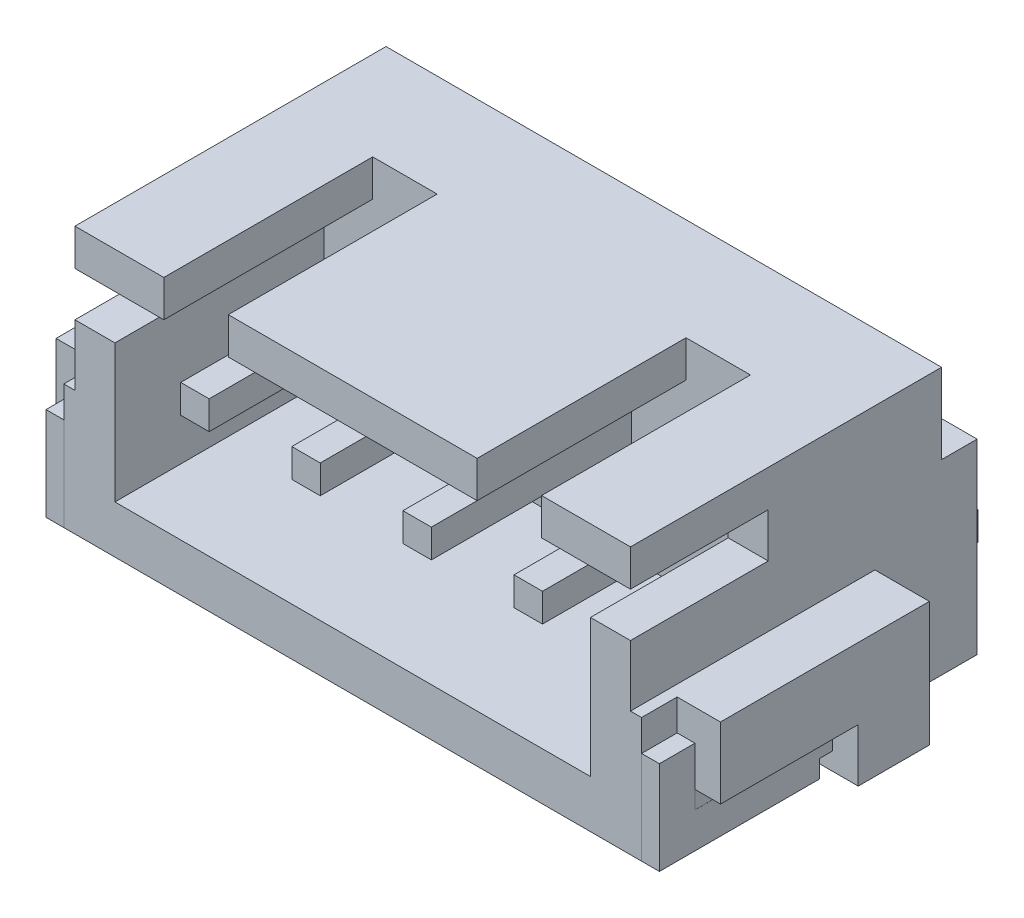
from build123d import *

# Parameters (mm, degrees)
BOSS_EXTRUDE1_START  = -5
BOSS_EXTRUDE1_DEPTH  = 6.86
BOSS_EXTRUDE2_START  = 0.64
BOSS_EXTRUDE2_DEPTH  = 0.64
BOSS_EXTRUDE3_DEPTH  = 0.64
CUT_EXTRUDE1_START   = -1.86
CUT_EXTRUDE1_DEPTH   = 1.86
CUT_EXTRUDE2_START   = -1.86
CUT_EXTRUDE2_DEPTH   = 1.86
CUT_EXTRUDE3_START   = -1.86
CUT_EXTRUDE3_DEPTH   = 1.86
SKETCH7_W            = 7
SKETCH7_H            = 6
BOSS_EXTRUDE4_DEPTH  = 2.18
SKETCH8_W            = 7
SKETCH8_H            = 6
BOSS_EXTRUDE5_DEPTH  = 2.18
SKETCH9_W            = 0.64
SKETCH9_H            = 0.64
BOSS_EXTRUDE6_DEPTH  = 2.2
SKETCH10_W           = 0.64
SKETCH10_H           = 0.64
BOSS_EXTRUDE7_DEPTH  = 2.2
SKETCH11_W           = 0.64
SKETCH11_H           = 0.64
BOSS_EXTRUDE8_DEPTH  = 2.2
SKETCH12_W           = 0.64
SKETCH12_H           = 0.64
BOSS_EXTRUDE9_DEPTH  = 2.2
BOSS_EXTRUDE10_DEPTH = 2.8
SKETCH14_W           = 0.574
SKETCH14_H           = 0.8
CUT_EXTRUDE4_DEPTH   = 3.1
SKETCH15_W           = 0.401
SKETCH15_H           = 3.1
CUT_EXTRUDE5_DEPTH   = 0.4
CUT_EXTRUDE6_REACH   = 17.295
SKETCH17_W           = 3.1
SKETCH17_H           = 0.4
SKETCH18_W           = 0.4
SKETCH18_H           = 2.8
BOSS_EXTRUDE11_DEPTH = 0.4
SKETCH19_W           = 0.4
SKETCH19_H           = 2.1
BOSS_EXTRUDE12_DEPTH = 0.8
BOSS_EXTRUDE13_DEPTH = 2.8
SKETCH21_W           = 0.574
SKETCH21_H           = 0.8
CUT_EXTRUDE7_DEPTH   = 3.1
SKETCH22_W           = 0.401
SKETCH22_H           = 3.1
CUT_EXTRUDE8_DEPTH   = 0.4
CUT_EXTRUDE9_REACH   = 18.36
SKETCH24_W           = 0.4
SKETCH24_H           = 3.1
SKETCH25_W           = 0.4
SKETCH25_H           = 2.8
BOSS_EXTRUDE14_DEPTH = 0.4
SKETCH26_W           = 0.4
SKETCH26_H           = 2.1
BOSS_EXTRUDE15_DEPTH = 0.8
SKETCH29_W           = 3.1
SKETCH29_H           = 1.825
CUT_EXTRUDE11_DEPTH  = 16.791631486
SKETCH30_W           = 2
SKETCH30_H           = 0.825
BOSS_EXTRUDE16_DEPTH = 3.1
SKETCH31_W           = 2
SKETCH31_H           = 0.825
BOSS_EXTRUDE17_DEPTH = 3.1
SKETCH32_W           = 8.5
SKETCH32_H           = 1.825
CUT_EXTRUDE12_DEPTH  = 1.6
CUT_EXTRUDE13_REACH  = 17.016
SKETCH33_W           = 1.6
SKETCH33_H           = 1
CUT_EXTRUDE14_REACH  = 17.016
SKETCH34_W           = 1
SKETCH34_H           = 1.6
SKETCH35_W           = 10.7
SKETCH35_H           = 4.7
CUT_EXTRUDE15_DEPTH  = 3.1
CUT_EXTRUDE16_REACH  = 12.388
SKETCH37_W           = 0.001
SKETCH37_H           = 3.1
SKETCH38_W           = 2.15
SKETCH38_H           = 4.2
BOSS_EXTRUDE18_DEPTH = 0.8
SKETCH39_W           = 1.3
SKETCH39_H           = 2.95
CUT_EXTRUDE17_DEPTH  = 0.8
SKETCH40_W           = 2.15
SKETCH40_H           = 4.2
BOSS_EXTRUDE19_DEPTH = 0.8
SKETCH41_W           = 1.3
SKETCH41_H           = 2.95
CUT_EXTRUDE18_DEPTH  = 0.8
SKETCH42_W           = 0.7
SKETCH42_H           = 0.3
CUT_EXTRUDE19_DEPTH  = 1.25
SKETCH43_W           = 1.8
SKETCH43_H           = 0.8
BOSS_EXTRUDE20_DEPTH = 1.25
SKETCH44_W           = 0.7
SKETCH44_H           = 0.3
CUT_EXTRUDE20_DEPTH  = 1.25
SKETCH45_W           = 1.8
SKETCH45_H           = 0.8
BOSS_EXTRUDE21_DEPTH = 1.25
SKETCH46_W           = 0.7
SKETCH46_H           = 0.3
CUT_EXTRUDE21_DEPTH  = 1.25
SKETCH47_W           = 1.8
SKETCH47_H           = 0.8
BOSS_EXTRUDE22_DEPTH = 1.25
CUT_EXTRUDE22_REACH  = 13.695
SKETCH48_W           = 0.7
SKETCH48_H           = 1.25
SKETCH49_W           = 0.64
SKETCH49_H           = 0.64
BOSS_EXTRUDE23_DEPTH = 4.5
SKETCH50_W           = 0.64
SKETCH50_H           = 0.64
BOSS_EXTRUDE24_DEPTH = 4.5
SKETCH51_W           = 0.64
SKETCH51_H           = 0.64
BOSS_EXTRUDE25_DEPTH = 4.5
SKETCH52_W           = 5.6
SKETCH52_H           = 0.825
BOSS_EXTRUDE26_DEPTH = 4.7
SKETCH53_W           = 0.64
SKETCH53_H           = 0.64
BOSS_EXTRUDE27_DEPTH = 4.5
FILLET1_R            = 0.64
FILLET2_R            = 1.28


with BuildPart() as part:
    # Boss-Extrude1: read off the stored shape, not the designer's step
    # Boss-Extrude1 outline → Boss-Extrude1 (new body)
    with BuildSketch(Plane.ZY.offset(1.57).offset(BOSS_EXTRUDE1_START)):
        with BuildLine():
            Line((-2, 3.08832021), (-2, 0))
            Line((-2, 0), (5, 0))
            Line((5, 0), (5, 6))
            Line((5, 6), (-2, 6))
            Line((-2, 6), (-2, 3.851591758))
            ThreePointArc((-2, 3.851591758), (-2.581319933, 3.380541753), (-2.8, 2.665))
            Line((-2.8, 2.665), (-2.8, 0))
            Line((-2.8, 0), (-2.16, 0))
            Line((-2.16, 0), (-2.16, 2.665))
            ThreePointArc((-2.16, 2.665), (-2.118665182, 2.89127417), (-2, 3.08832021))
        make_face()
    extrude(amount=BOSS_EXTRUDE1_DEPTH)

    # Sketch2 → Boss-Extrude2 (add)
    with BuildSketch(Plane(origin=(3.43, 0, 0), x_dir=(0, 0, -1), z_dir=(1, 0, 0)).offset(BOSS_EXTRUDE2_START)):
        with BuildLine():
            Line((2.8, 0), (2.16, 0))
            Line((2.16, 0), (2.16, 2.665))
            ThreePointArc((2.16, 2.665), (2.118665182, 2.89127417), (2, 3.08832021))
            Line((2, 3.08832021), (2, 0))
            Line((2, 0), (-5, 0))
            Line((-5, 0), (-5, 6))
            Line((-5, 6), (2, 6))
            Line((2, 6), (2, 3.851591758))
            ThreePointArc((2, 3.851591758), (2.581319933, 3.380541753), (2.8, 2.665))
            Line((2.8, 2.665), (2.8, 0))
        make_face()
    extrude(amount=-BOSS_EXTRUDE2_DEPTH)

    # Sketch3 → Boss-Extrude3 (add)
    with BuildSketch(Plane.ZY.offset(3.43)):
        with BuildLine():
            Line((-2.8, 0), (-2.8, 2.665))
            ThreePointArc((-2.8, 2.665), (-2.581319933, 3.380541753), (-2, 3.851591758))
            Line((-2, 3.851591758), (-2, 6))
            Line((-2, 6), (5, 6))
            Line((5, 6), (5, 0))
            Line((5, 0), (-2, 0))
            Line((-2, 0), (-2, 3.08832021))
            ThreePointArc((-2, 3.08832021), (-2.118665182, 2.89127417), (-2.16, 2.665))
            Line((-2.16, 2.665), (-2.16, 0))
            Line((-2.16, 0), (-2.8, 0))
        make_face()
    extrude(amount=BOSS_EXTRUDE3_DEPTH)

    # Sketch4 → Cut-Extrude1 (cut)
    with BuildSketch(Plane(origin=(-3.43, 0, 0), x_dir=(0, -1, 0), z_dir=(-1, 0, 0)).offset(CUT_EXTRUDE1_START)):
        with BuildLine():
            Line((-2.665, -2.8), (0, -2.8))
            Line((0, -2.8), (0, -2.16))
            Line((0, -2.16), (-2.665, -2.16))
            ThreePointArc((-2.665, -2.16), (-2.89127417, -2.118665182), (-3.08832021, -2))
            Line((-3.08832021, -2), (-3.851591758, -2))
            ThreePointArc((-3.851591758, -2), (-3.380541753, -2.581319933), (-2.665, -2.8))
        make_face()
    extrude(amount=CUT_EXTRUDE1_DEPTH, mode=Mode.SUBTRACT)

    # Sketch5 → Cut-Extrude2 (cut)
    with BuildSketch(Plane(origin=(-0.93, 0, 0), x_dir=(0, -1, 0), z_dir=(-1, 0, 0)).offset(CUT_EXTRUDE2_START)):
        with BuildLine():
            Line((-2.665, -2.8), (0, -2.8))
            Line((0, -2.8), (0, -2.16))
            Line((0, -2.16), (-2.665, -2.16))
            ThreePointArc((-2.665, -2.16), (-2.89127417, -2.118665182), (-3.08832021, -2))
            Line((-3.08832021, -2), (-3.851591758, -2))
            ThreePointArc((-3.851591758, -2), (-3.380541753, -2.581319933), (-2.665, -2.8))
        make_face()
    extrude(amount=CUT_EXTRUDE2_DEPTH, mode=Mode.SUBTRACT)

    # Sketch6 → Cut-Extrude3 (cut)
    with BuildSketch(Plane(origin=(1.57, 0, 0), x_dir=(0, -1, 0), z_dir=(-1, 0, 0)).offset(CUT_EXTRUDE3_START)):
        with BuildLine():
            Line((-2.665, -2.8), (0, -2.8))
            Line((0, -2.8), (0, -2.16))
            Line((0, -2.16), (-2.665, -2.16))
            ThreePointArc((-2.665, -2.16), (-2.89127417, -2.118665182), (-3.08832021, -2))
            Line((-3.08832021, -2), (-3.851591758, -2))
            ThreePointArc((-3.851591758, -2), (-3.380541753, -2.581319933), (-2.665, -2.8))
        make_face()
    extrude(amount=CUT_EXTRUDE3_DEPTH, mode=Mode.SUBTRACT)

    # Sketch7 → Boss-Extrude4 (add)
    with BuildSketch(Plane.ZY.offset(4.07)):
        with Locations((1.5, 3)):
            Rectangle(SKETCH7_W, SKETCH7_H)
    extrude(amount=BOSS_EXTRUDE4_DEPTH)

    # Sketch8 → Boss-Extrude5 (add)
    with BuildSketch(Plane(origin=(4.07, 0, 0), x_dir=(0, 0, -1), z_dir=(1, 0, 0))):
        with Locations((-1.5, 3)):
            Rectangle(SKETCH8_W, SKETCH8_H)
    extrude(amount=BOSS_EXTRUDE5_DEPTH)

    # Sketch9 → Boss-Extrude6 (add)
    with BuildSketch(Plane(origin=(0, 0, -2.8), x_dir=(-1, 0, 0), z_dir=(0, 0, -1))):
        with Locations((3.75, 0.32)):
            Rectangle(SKETCH9_W, SKETCH9_H)
    extrude(amount=BOSS_EXTRUDE6_DEPTH)

    # Sketch10 → Boss-Extrude7 (add)
    with BuildSketch(Plane(origin=(0, 0, -2.8), x_dir=(-1, 0, 0), z_dir=(0, 0, -1))):
        with Locations((1.25, 0.32)):
            Rectangle(SKETCH10_W, SKETCH10_H)
    extrude(amount=BOSS_EXTRUDE7_DEPTH)

    # Sketch11 → Boss-Extrude8 (add)
    with BuildSketch(Plane(origin=(0, 0, -2.8), x_dir=(-1, 0, 0), z_dir=(0, 0, -1))):
        with Locations((-1.25, 0.32)):
            Rectangle(SKETCH11_W, SKETCH11_H)
    extrude(amount=BOSS_EXTRUDE8_DEPTH)

    # Sketch12 → Boss-Extrude9 (add)
    with BuildSketch(Plane(origin=(0, 0, -2.8), x_dir=(-1, 0, 0), z_dir=(0, 0, -1))):
        with Locations((-3.75, 0.32)):
            Rectangle(SKETCH12_W, SKETCH12_H)
    extrude(amount=BOSS_EXTRUDE9_DEPTH)

    # Sketch13 → Boss-Extrude10 (add)
    with BuildSketch(Plane.XZ):
        Polygon((-7.475, -0.5), (-6.25, -0.5), (-6.25, 5), (-6.5, 5), (-6.5, 4.2), (-7.475, 4.2), align=None)
    extrude(amount=-BOSS_EXTRUDE10_DEPTH)

    # Sketch14 → Cut-Extrude4 (cut)
    with BuildSketch(Plane.XY.offset(4.2)):
        with Locations((-7.188, 0.4)):
            Rectangle(SKETCH14_W, SKETCH14_H)
    extrude(amount=-CUT_EXTRUDE4_DEPTH, mode=Mode.SUBTRACT)

    # Sketch15 → Cut-Extrude5 (cut)
    with BuildSketch(Plane.XZ):
        with Locations((-6.7005, 2.65)):
            Rectangle(SKETCH15_W, SKETCH15_H)
    extrude(amount=-CUT_EXTRUDE5_DEPTH, mode=Mode.SUBTRACT)

    # Sketch17 → Cut-Extrude6 (cut, up to next)
    with BuildSketch(Plane(origin=(-6.9, 0, 0), x_dir=(0, 0, -1), z_dir=(1, 0, 0)), mode=Mode.PRIVATE) as cut_extrude6_sk1:
        with Locations((-2.65, 1)):
            Rectangle(SKETCH17_W, SKETCH17_H)
    cut_extrude6_tool1 = extrude(cut_extrude6_sk1.sketch, amount=-CUT_EXTRUDE6_REACH, mode=Mode.PRIVATE) & part.part
    add(cut_extrude6_tool1.solids().sort_by_distance((-6.9, 1, 2.65))[0], mode=Mode.SUBTRACT)

    # Sketch18 → Boss-Extrude11 (add)
    with BuildSketch(Plane.XZ.offset(-0.4)):
        with Locations((-6.701, 2.8)):
            Rectangle(SKETCH18_W, SKETCH18_H)
    extrude(amount=BOSS_EXTRUDE11_DEPTH)

    # Sketch19 → Boss-Extrude12 (add)
    with BuildSketch(Plane.XY.offset(4.2)):
        with Locations((-6.701, 1.05)):
            Rectangle(SKETCH19_W, SKETCH19_H)
    extrude(amount=BOSS_EXTRUDE12_DEPTH)

    # Sketch20 → Boss-Extrude13 (add)
    with BuildSketch(Plane.XZ):
        Polygon((6.25, -0.5), (7.475, -0.5), (7.475, 4.2), (6.5, 4.2), (6.5, 5), (6.25, 5), align=None)
    extrude(amount=-BOSS_EXTRUDE13_DEPTH)

    # Sketch21 → Cut-Extrude7 (cut)
    with BuildSketch(Plane.XY.offset(4.2)):
        with Locations((7.188, 0.4)):
            Rectangle(SKETCH21_W, SKETCH21_H)
    extrude(amount=-CUT_EXTRUDE7_DEPTH, mode=Mode.SUBTRACT)

    # Sketch22 → Cut-Extrude8 (cut)
    with BuildSketch(Plane.XZ):
        with Locations((6.7005, 2.65)):
            Rectangle(SKETCH22_W, SKETCH22_H)
    extrude(amount=-CUT_EXTRUDE8_DEPTH, mode=Mode.SUBTRACT)

    # Sketch24 → Cut-Extrude9 (cut, up to next)
    with BuildSketch(Plane(origin=(6.9, 0, 0), x_dir=(0, -1, 0), z_dir=(-1, 0, 0)), mode=Mode.PRIVATE) as cut_extrude9_sk1:
        with Locations((-1, 2.65)):
            Rectangle(SKETCH24_W, SKETCH24_H)
    cut_extrude9_tool1 = extrude(cut_extrude9_sk1.sketch, amount=-CUT_EXTRUDE9_REACH, mode=Mode.PRIVATE) & part.part
    add(cut_extrude9_tool1.solids().sort_by_distance((6.9, 1, 2.65))[0], mode=Mode.SUBTRACT)

    # Sketch25 → Boss-Extrude14 (add)
    with BuildSketch(Plane.XZ.offset(-0.4)):
        with Locations((6.701, 2.8)):
            Rectangle(SKETCH25_W, SKETCH25_H)
    extrude(amount=BOSS_EXTRUDE14_DEPTH)

    # Sketch26 → Boss-Extrude15 (add)
    with BuildSketch(Plane.XY.offset(4.2)):
        with Locations((6.701, 1.05)):
            Rectangle(SKETCH26_W, SKETCH26_H)
    extrude(amount=BOSS_EXTRUDE15_DEPTH)

    # Sketch29 → Cut-Extrude11 (cut, through all)
    with BuildSketch(Plane.ZY.offset(6.25)):
        with Locations((3.45, 5.0875)):
            Rectangle(SKETCH29_W, SKETCH29_H)
    extrude(amount=-CUT_EXTRUDE11_DEPTH, mode=Mode.SUBTRACT)

    # Sketch30 → Boss-Extrude16 (add)
    with BuildSketch(Plane.XY.offset(1.9)):
        with Locations((-5.25, 5.5875)):
            Rectangle(SKETCH30_W, SKETCH30_H)
    extrude(amount=BOSS_EXTRUDE16_DEPTH)

    # Sketch31 → Boss-Extrude17 (add)
    with BuildSketch(Plane.XY.offset(1.9)):
        with Locations((5.25, 5.5875)):
            Rectangle(SKETCH31_W, SKETCH31_H)
    extrude(amount=BOSS_EXTRUDE17_DEPTH)

    # Sketch32 → Cut-Extrude12 (cut)
    with BuildSketch(Plane.XY.offset(1.9)):
        with Locations((0, 5.0875)):
            Rectangle(SKETCH32_W, SKETCH32_H)
    extrude(amount=-CUT_EXTRUDE12_DEPTH, mode=Mode.SUBTRACT)

    # Sketch33 → Cut-Extrude13 (cut, up to next)
    with BuildSketch(Plane(origin=(5.35, 0, 0), x_dir=(0, 0, -1), z_dir=(1, 0, 0)), mode=Mode.PRIVATE) as cut_extrude13_sk1:
        with Locations((-1.1, 4.675)):
            Rectangle(SKETCH33_W, SKETCH33_H)
    cut_extrude13_tool1 = extrude(cut_extrude13_sk1.sketch, amount=-CUT_EXTRUDE13_REACH, mode=Mode.PRIVATE) & part.part
    add(cut_extrude13_tool1.solids().sort_by_distance((5.35, 4.675, 1.1))[0], mode=Mode.SUBTRACT)

    # Sketch34 → Cut-Extrude14 (cut, up to next)
    with BuildSketch(Plane(origin=(-5.35, 0, 0), x_dir=(0, -1, 0), z_dir=(-1, 0, 0)), mode=Mode.PRIVATE) as cut_extrude14_sk1:
        with Locations((-4.675, 1.1)):
            Rectangle(SKETCH34_W, SKETCH34_H)
    cut_extrude14_tool1 = extrude(cut_extrude14_sk1.sketch, amount=-CUT_EXTRUDE14_REACH, mode=Mode.PRIVATE) & part.part
    add(cut_extrude14_tool1.solids().sort_by_distance((-5.35, 4.675, 1.1))[0], mode=Mode.SUBTRACT)

    # Sketch35 → Cut-Extrude15 (cut)
    with BuildSketch(Plane(origin=(0, 4.175, 0), x_dir=(-1, 0, 0), z_dir=(0, 1, 0))):
        with Locations((0, 2.65)):
            Rectangle(SKETCH35_W, SKETCH35_H)
    extrude(amount=-CUT_EXTRUDE15_DEPTH, mode=Mode.SUBTRACT)

    # Sketch37 → Cut-Extrude16 (cut, up to next)
    with BuildSketch(Plane(origin=(0, 0.8, 0), x_dir=(1, 0, 0), z_dir=(0, 1, 0)), mode=Mode.PRIVATE) as cut_extrude16_sk1:
        with Locations((6.5005, -2.65)):
            Rectangle(SKETCH37_W, SKETCH37_H)
    cut_extrude16_tool1 = extrude(cut_extrude16_sk1.sketch, amount=-CUT_EXTRUDE16_REACH, mode=Mode.PRIVATE) & part.part
    add(cut_extrude16_tool1.solids().sort_by_distance((6.5005, 0.8, 2.65))[0], mode=Mode.SUBTRACT)

    # Sketch38 → Boss-Extrude18 (add)
    with BuildSketch(Plane(origin=(0, 0, -2), x_dir=(-1, 0, 0), z_dir=(0, 0, -1))):
        with Locations((5.175, 2.1)):
            Rectangle(SKETCH38_W, SKETCH38_H)
    extrude(amount=BOSS_EXTRUDE18_DEPTH)

    # Sketch39 → Cut-Extrude17 (cut)
    with BuildSketch(Plane(origin=(0, 0, -2.8), x_dir=(-1, 0, 0), z_dir=(0, 0, -1))):
        with Locations((4.75, 2.725)):
            Rectangle(SKETCH39_W, SKETCH39_H)
    extrude(amount=-CUT_EXTRUDE17_DEPTH, mode=Mode.SUBTRACT)

    # Sketch40 → Boss-Extrude19 (add)
    with BuildSketch(Plane(origin=(0, 0, -2), x_dir=(-1, 0, 0), z_dir=(0, 0, -1))):
        with Locations((-5.175, 2.1)):
            Rectangle(SKETCH40_W, SKETCH40_H)
    extrude(amount=BOSS_EXTRUDE19_DEPTH)

    # Sketch41 → Cut-Extrude18 (cut)
    with BuildSketch(Plane(origin=(0, 0, -2.8), x_dir=(-1, 0, 0), z_dir=(0, 0, -1))):
        with Locations((-4.75, 2.725)):
            Rectangle(SKETCH41_W, SKETCH41_H)
    extrude(amount=-CUT_EXTRUDE18_DEPTH, mode=Mode.SUBTRACT)

    # Sketch42 → Cut-Extrude19 (cut)
    with BuildSketch(Plane.XZ):
        with Locations((3.75, -1.85)):
            Rectangle(SKETCH42_W, SKETCH42_H)
    extrude(amount=-CUT_EXTRUDE19_DEPTH, mode=Mode.SUBTRACT)

    # Sketch43 → Boss-Extrude20 (add)
    with BuildSketch(Plane.XZ):
        with Locations((2.5, -2.4)):
            Rectangle(SKETCH43_W, SKETCH43_H)
    extrude(amount=-BOSS_EXTRUDE20_DEPTH)

    # Sketch44 → Cut-Extrude20 (cut)
    with BuildSketch(Plane.XZ):
        with Locations((1.25, -1.85)):
            Rectangle(SKETCH44_W, SKETCH44_H)
    extrude(amount=-CUT_EXTRUDE20_DEPTH, mode=Mode.SUBTRACT)

    # Sketch45 → Boss-Extrude21 (add)
    with BuildSketch(Plane.XZ):
        with Locations((0, -2.4)):
            Rectangle(SKETCH45_W, SKETCH45_H)
    extrude(amount=-BOSS_EXTRUDE21_DEPTH)

    # Sketch46 → Cut-Extrude21 (cut)
    with BuildSketch(Plane.XZ):
        with Locations((-1.25, -1.85)):
            Rectangle(SKETCH46_W, SKETCH46_H)
    extrude(amount=-CUT_EXTRUDE21_DEPTH, mode=Mode.SUBTRACT)

    # Sketch47 → Boss-Extrude22 (add)
    with BuildSketch(Plane.XZ):
        with Locations((-2.5, -2.4)):
            Rectangle(SKETCH47_W, SKETCH47_H)
    extrude(amount=-BOSS_EXTRUDE22_DEPTH)

    # Sketch48 → Cut-Extrude22 (cut, up to next)
    with BuildSketch(Plane.XY.offset(-1.7), mode=Mode.PRIVATE) as cut_extrude22_sk1:
        with Locations((-3.75, 0.625)):
            Rectangle(SKETCH48_W, SKETCH48_H)
    cut_extrude22_tool1 = extrude(cut_extrude22_sk1.sketch, amount=-CUT_EXTRUDE22_REACH, mode=Mode.PRIVATE) & part.part
    add(cut_extrude22_tool1.solids().sort_by_distance((-3.75, 0.625, -1.7))[0], mode=Mode.SUBTRACT)

    # Sketch49 → Boss-Extrude23 (add)
    with BuildSketch(Plane.XY.offset(0.3)):
        with Locations((-3.75, 3.625)):
            Rectangle(SKETCH49_W, SKETCH49_H)
    extrude(amount=BOSS_EXTRUDE23_DEPTH)

    # Sketch50 → Boss-Extrude24 (add)
    with BuildSketch(Plane.XY.offset(0.3)):
        with Locations((-1.25, 3.625)):
            Rectangle(SKETCH50_W, SKETCH50_H)
    extrude(amount=BOSS_EXTRUDE24_DEPTH)

    # Sketch51 → Boss-Extrude25 (add)
    with BuildSketch(Plane.XY.offset(0.3)):
        with Locations((1.25, 3.625)):
            Rectangle(SKETCH51_W, SKETCH51_H)
    extrude(amount=BOSS_EXTRUDE25_DEPTH)

    # Sketch52 → Boss-Extrude26 (add)
    with BuildSketch(Plane.XY.offset(0.3)):
        with Locations((0, 5.5875)):
            Rectangle(SKETCH52_W, SKETCH52_H)
    extrude(amount=BOSS_EXTRUDE26_DEPTH)

    # Sketch53 → Boss-Extrude27 (add)
    with BuildSketch(Plane.XY.offset(0.3)):
        with Locations((3.75, 3.625)):
            Rectangle(SKETCH53_W, SKETCH53_H)
    extrude(amount=BOSS_EXTRUDE27_DEPTH)

    # Fillet1
    fillet1_edges = [part.edges().sort_by_distance(p)[0] for p in [
        (-3.75, 0.64, -2.8),
        (-1.25, 0.64, -2.8),
        (1.25, 0.64, -2.8),
        (3.75, 0.64, -2.8),
    ]]
    fillet(fillet1_edges, radius=FILLET1_R)

    # Fillet2
    fillet2_edges = [part.edges().sort_by_distance(p)[0] for p in [
        (-3.75, 0, -2.16),
        (-1.25, 0, -2.16),
        (1.25, 0, -2.16),
        (3.75, 0, -2.16),
    ]]
    fillet(fillet2_edges, radius=FILLET2_R)


solid = part.part
